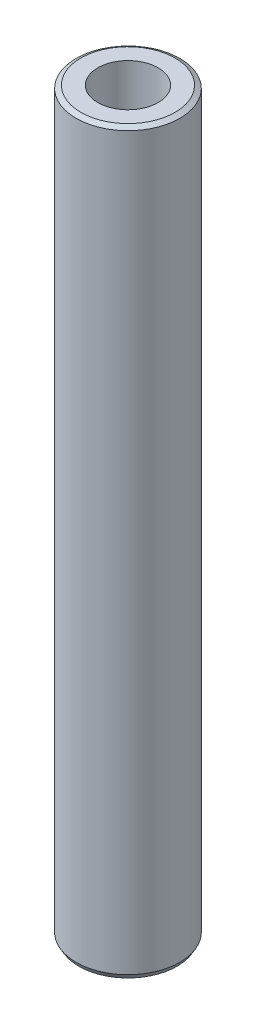
from build123d import *
from OCP.BRepFilletAPI import BRepFilletAPI_MakeChamfer

# Parameters (mm, degrees)
SKETCH1_R           = 37.5
BOSS_EXTRUDE1_DEPTH = 533.716949226
SKETCH2_R           = 21.799693833
CUT_EXTRUDE1_DEPTH  = 537.345300988
CHAMFER1_SIZE       = 1.996035703
CHAMFER1_SIZE2      = 3.457235251


with BuildPart() as part:
    # Sketch1 → Boss-Extrude1 (new body)
    with BuildSketch(Plane(origin=(0, 0, 0), x_dir=(1, 0, 0), z_dir=(0, 1, 0))):
        Circle(SKETCH1_R)
    extrude(amount=BOSS_EXTRUDE1_DEPTH)

    # Sketch2 → Cut-Extrude1 (cut, through all)
    with BuildSketch(Plane(origin=(0, 0, 0), x_dir=(1, 0, 0), z_dir=(0, 1, 0))):
        Circle(SKETCH2_R)
    extrude(amount=CUT_EXTRUDE1_DEPTH, mode=Mode.SUBTRACT)

    # Chamfer1: one chamfer whose edges measure the first distance from different faces: ONE call of the kernel's chamfer builder (chamfer() names one face for all edges)
    chamfer1_edges_1 = [part.edges().sort_by_distance(p)[0] for p in [
        (-37.5, 533.716949226, 0),
    ]]
    chamfer1_side_1 = [part.faces().sort_by_distance(p)[0] for p in [
        (-37.5, 266.858474613, 0),
    ]]
    chamfer1_edges_2 = [part.edges().sort_by_distance(p)[0] for p in [
        (-37.5, 0, 0),
    ]]
    chamfer1_side_2 = [part.faces().sort_by_distance(p)[0] for p in [
        (-36.439339828, 0, 0),
    ]]
    chamfer1 = BRepFilletAPI_MakeChamfer(part.part.solid().wrapped)
    for e in chamfer1_edges_1:
        chamfer1.Add(CHAMFER1_SIZE, CHAMFER1_SIZE2, e.wrapped, chamfer1_side_1[0].wrapped)  # the first distance lies on this face
    for e in chamfer1_edges_2:
        chamfer1.Add(CHAMFER1_SIZE, CHAMFER1_SIZE2, e.wrapped, chamfer1_side_2[0].wrapped)  # the first distance lies on this face
    add(Compound.cast(chamfer1.Shape()), mode=Mode.REPLACE)


solid = part.part
